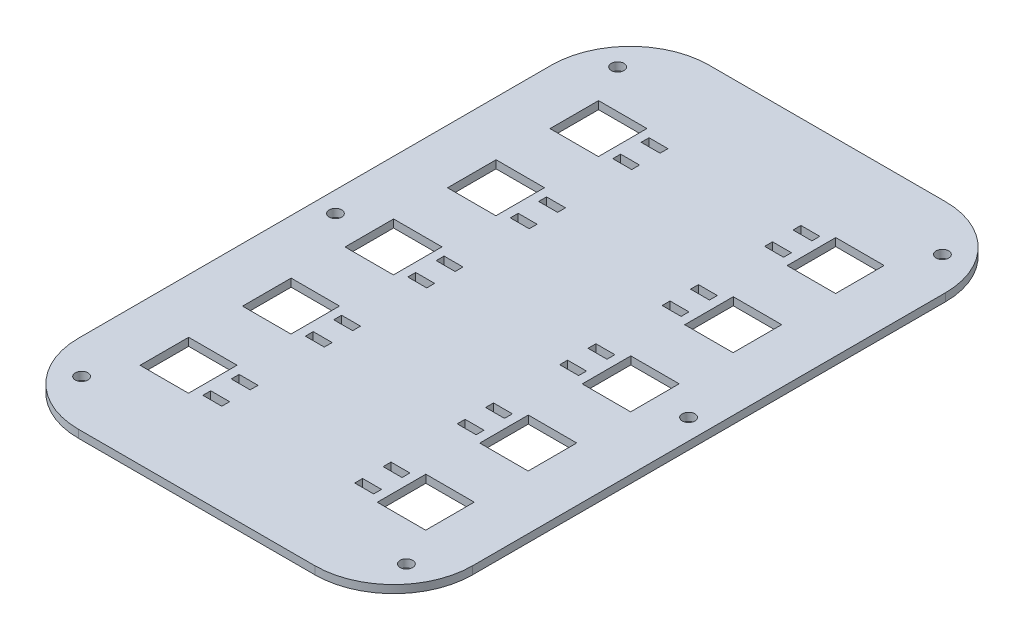
from build123d import *

# Parameters (mm, degrees)
BOSS_EXTRUDE1_DEPTH = 5
SKETCH3_W           = 30.7
SKETCH3_H           = 30.8
CUT_EXTRUDE1_DEPTH  = 10
LPATTERN1_COUNT     = 5
LPATTERN1_PITCH     = 65
SKETCH4_W           = 12
SKETCH4_H           = 5
CUT_EXTRUDE2_DEPTH  = 10
LPATTERN2_COUNT     = 5
LPATTERN2_PITCH     = 65
SKETCH5_R           = 4
CUT_EXTRUDE3_DEPTH  = 5


with BuildPart() as part:
    # Sketch1 → Boss-Extrude1 (new body)
    with BuildSketch(Plane(origin=(0, 0, 0), x_dir=(1, 0, 0), z_dir=(0, 1, 0))):
        with BuildLine():
            Line((-75, 200), (75, 200))
            ThreePointArc((75, 200), (110.355339059, 185.355339059), (125, 150))
            Line((125, 150), (125, -150))
            ThreePointArc((125, -150), (110.355339059, -185.355339059), (75, -200))
            Line((75, -200), (-75, -200))
            ThreePointArc((-75, -200), (-110.355339059, -185.355339059), (-125, -150))
            Line((-125, -150), (-125, 150))
            ThreePointArc((-125, 150), (-110.355339059, 185.355339059), (-75, 200))
        make_face()
    extrude(amount=BOSS_EXTRUDE1_DEPTH)

    # Sketch3 → Cut-Extrude1 (cut)
    with BuildSketch(Plane.XZ):
        with Locations((-75.225, 129.928570167)):
            Rectangle(SKETCH3_W, SKETCH3_H)
        with Locations((75.225, 129.928570167)):
            Rectangle(SKETCH3_W, SKETCH3_H)
    cut_extrude1 = extrude(amount=-CUT_EXTRUDE1_DEPTH, mode=Mode.SUBTRACT)

    # LPattern1: Cut-Extrude1 ×5
    with Locations(*[(0, 0, -i * LPATTERN1_PITCH) for i in range(1, LPATTERN1_COUNT)]):
        add(cut_extrude1, mode=Mode.SUBTRACT)

    # Sketch4 → Cut-Extrude2 (cut)
    with BuildSketch(Plane(origin=(0, 5, 0), x_dir=(1, 0, 0), z_dir=(0, 1, 0))):
        with Locations((-48.165, -121.42)):
            Rectangle(SKETCH4_W, SKETCH4_H)
        with Locations((-48.165, -139.42)):
            Rectangle(SKETCH4_W, SKETCH4_H)
        with Locations((48.165, -139.42)):
            Rectangle(SKETCH4_W, SKETCH4_H)
        with Locations((48.165, -121.42)):
            Rectangle(SKETCH4_W, SKETCH4_H)
    cut_extrude2 = extrude(amount=-CUT_EXTRUDE2_DEPTH, mode=Mode.SUBTRACT)

    # LPattern2: Cut-Extrude2 ×5
    with Locations(*[(0, 0, -i * LPATTERN2_PITCH) for i in range(1, LPATTERN2_COUNT)]):
        add(cut_extrude2, mode=Mode.SUBTRACT)

    # Sketch5 → Cut-Extrude3 (cut)
    with BuildSketch(Plane(origin=(0, 5, 0), x_dir=(1, 0, 0), z_dir=(0, 1, 0))):
        with Locations((-103, 170)):
            Circle(SKETCH5_R)
        with Locations((103, 170)):
            Circle(SKETCH5_R)
        with Locations((103, -170)):
            Circle(SKETCH5_R)
        with Locations((-103, -170)):
            Circle(SKETCH5_R)
        with Locations((-112, 0)):
            Circle(SKETCH5_R)
        with Locations((112, 0)):
            Circle(SKETCH5_R)
    extrude(amount=-CUT_EXTRUDE3_DEPTH, mode=Mode.SUBTRACT)


solid = part.part
